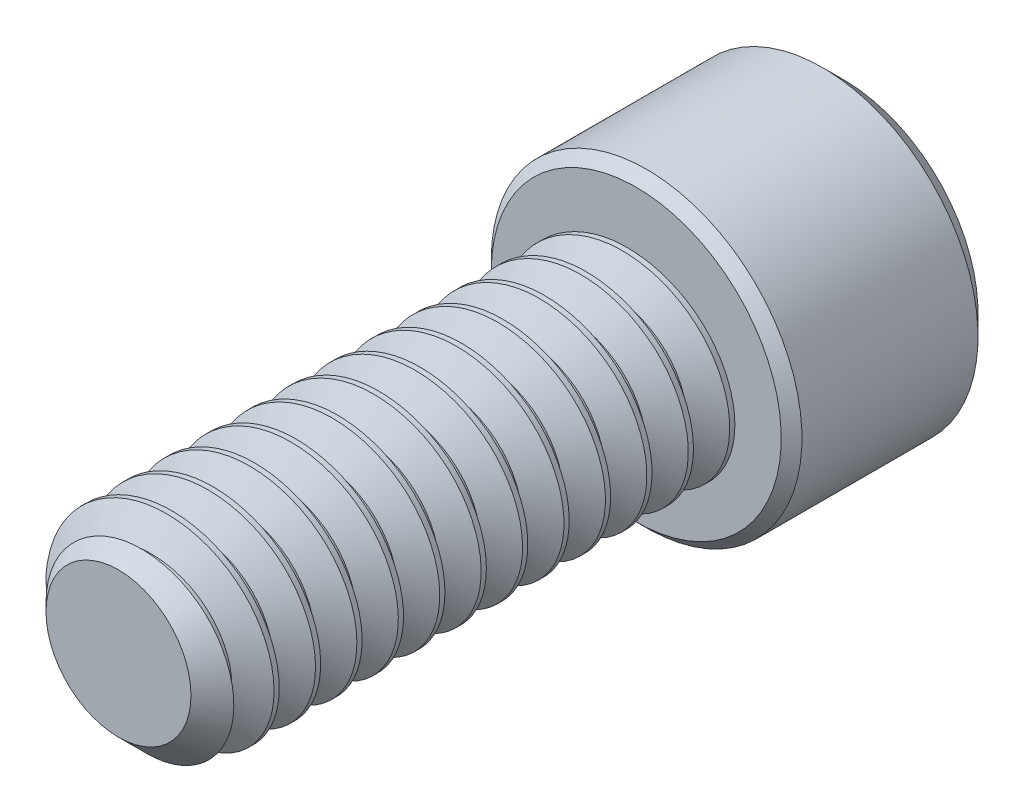
from build123d import *

# Parameters (mm, degrees)
SKETCH1_R          = 3.175
EXTRUDE1_DEPTH     = 15.875
CHAMFER3_SIZE      = 0.9525
CUT_SWEEP1_PITCH   = 1.27
SKETCH6_R          = 4.7625
EXTRUDE2_DEPTH     = 6.35
CUT_EXTRUDE1_DEPTH = 3.571875
SKETCH8_R          = 2.749630657
CUT_EXTRUDE2_DEPTH = 0.635
CUT_EXTRUDE2_DRAFT = -45
CHAMFER1_SIZE      = 0.635
CHAMFER2_SIZE      = 0.3175


with BuildPart() as part:
    # Sketch1 → Extrude1 (new body)
    with BuildSketch(Plane.XY):
        Circle(SKETCH1_R)
    extrude(amount=-EXTRUDE1_DEPTH)

    # Chamfer3
    chamfer3_edges = [part.edges().sort_by_distance(p)[0] for p in [
        (-3.175, 0, 0),
    ]]
    chamfer(chamfer3_edges, length=CHAMFER3_SIZE)

    # Cut-Sweep1: the profile of Sketch3 profile screwed along a right-hand helix of 13.5 turns, 6 arcs to a turn; built about Z, then put on its axis
    cut_sweep1_z = Axis((0, 0, 0), (0, 0, 1))
    cut_sweep1_corners = [(3.1753, 0, -1.111423205), (2.350110803, 0, -0.635), (2.350110803, 0, -0.47625), (3.1753, 0, 0.000173205)]
    with BuildLine(mode=Mode.PRIVATE) as cut_sweep1_profile:
        Line(cut_sweep1_corners[0], cut_sweep1_corners[1])
        Line(cut_sweep1_corners[1], cut_sweep1_corners[2])
        Line(cut_sweep1_corners[2], cut_sweep1_corners[3])
        Line(cut_sweep1_corners[3], cut_sweep1_corners[0])
    cut_sweep1_cap = Face(cut_sweep1_profile.wire())
    cut_sweep1_turn_angles = [0, 30, 60, 90, 120, 150, 180, 210, 240, 270, 300, 330, 360]
    cut_sweep1_turn_weights = [1, 0.8660254037844387, 1, 0.8660254037844387, 1, 0.8660254037844387, 1, 0.8660254037844387, 1, 0.8660254037844387, 1, 0.8660254037844387, 1]
    cut_sweep1_turn_rails = [Edge.make_bspline([Vector(p[0], p[1], 0).rotate(cut_sweep1_z, cut_sweep1_turn_angles[k]) / cut_sweep1_turn_weights[k] + Vector(0, 0, p[2] + CUT_SWEEP1_PITCH * cut_sweep1_turn_angles[k] / 360) for k in range(13)], [0, 0, 0, 1, 1, 2, 2, 3, 3, 4, 4, 5, 5, 6, 6, 6], 2, cut_sweep1_turn_weights) for p in cut_sweep1_corners]
    cut_sweep1_turn_sides = [Face.make_surface_from_curves(cut_sweep1_turn_rails[p[0]], cut_sweep1_turn_rails[p[1]]) for p in [(0, 1), (1, 2), (2, 3), (3, 0)]]
    cut_sweep1_last_angles = [4680, 4710, 4740, 4770, 4800, 4830, 4860]
    cut_sweep1_last_weights = [1, 0.8660254037844387, 1, 0.8660254037844387, 1, 0.8660254037843712, 1]
    cut_sweep1_last_rails = [Edge.make_bspline([Vector(p[0], p[1], 0).rotate(cut_sweep1_z, cut_sweep1_last_angles[k]) / cut_sweep1_last_weights[k] + Vector(0, 0, p[2] + CUT_SWEEP1_PITCH * cut_sweep1_last_angles[k] / 360) for k in range(7)], [0, 0, 0, 1, 1, 2, 2, 3, 3, 3], 2, cut_sweep1_last_weights) for p in cut_sweep1_corners]
    cut_sweep1_last_sides = [Face.make_surface_from_curves(cut_sweep1_last_rails[p[0]], cut_sweep1_last_rails[p[1]]) for p in [(0, 1), (1, 2), (2, 3), (3, 0)]]
    cut_sweep1 = Plane(origin=(0, 0, 0), x_dir=(0, 1, 0), z_dir=(0, 0, -1)) * Solid(Shell([*[p.moved(Location((0, 0, CUT_SWEEP1_PITCH * i))) for i in range(13) for p in cut_sweep1_turn_sides], *cut_sweep1_last_sides, cut_sweep1_cap, cut_sweep1_cap.rotate(cut_sweep1_z, 4860).moved(Location((0, 0, CUT_SWEEP1_PITCH * 4860 / 360)))]))
    add(cut_sweep1, mode=Mode.SUBTRACT)

    # Sketch6 → Extrude2 (add)
    with BuildSketch(Plane(origin=(0, 0, -15.875), x_dir=(-1, 0, 0), z_dir=(0, 0, -1))):
        Circle(SKETCH6_R)
    extrude(amount=EXTRUDE2_DEPTH)

    # Sketch7 → Cut-Extrude1 (cut)
    with BuildSketch(Plane(origin=(0, 0, -22.225), x_dir=(-1, 0, 0), z_dir=(0, 0, -1))):
        Polygon((0, 2.749630657), (-2.38125, 1.374815329), (-2.38125, -1.374815329), (0, -2.749630657), (2.38125, -1.374815329), (2.38125, 1.374815329), align=None)
    extrude(amount=-CUT_EXTRUDE1_DEPTH, mode=Mode.SUBTRACT)


with BuildPart() as cut_extrude2_tool:
    # Sketch8 → Cut-Extrude2 (with draft: the straight prism first)
    with BuildSketch(Plane(origin=(0, 0, -22.225), x_dir=(-1, 0, 0), z_dir=(0, 0, -1))):
        Circle(SKETCH8_R)
    extrude(amount=-CUT_EXTRUDE2_DEPTH)
    # Cut-Extrude2: the draft: its side faces are tilted about the plane it starts from
    cut_extrude2_sides = [cut_extrude2_tool.faces().sort_by_distance(p)[0] for p in [
        (2.749630657, 0, -21.9075),
    ]]
    draft(cut_extrude2_sides, Plane(origin=(0, 0, -22.225), x_dir=(-1, 0, 0), z_dir=(0, 0, -1)), CUT_EXTRUDE2_DRAFT)


with BuildPart() as part_1:
    add(part.part)

    # Cut-Extrude2: cut by cut_extrude2_tool
    add(cut_extrude2_tool.part, mode=Mode.SUBTRACT)

    # Chamfer1
    chamfer1_edges = [part_1.edges().sort_by_distance(p)[0] for p in [
        (4.7625, 0, -22.225),
    ]]
    chamfer(chamfer1_edges, length=CHAMFER1_SIZE)

    # Chamfer2
    chamfer2_edges = [part_1.edges().sort_by_distance(p)[0] for p in [
        (4.7625, 0, -15.875),
    ]]
    chamfer(chamfer2_edges, length=CHAMFER2_SIZE)


solid = part_1.part
